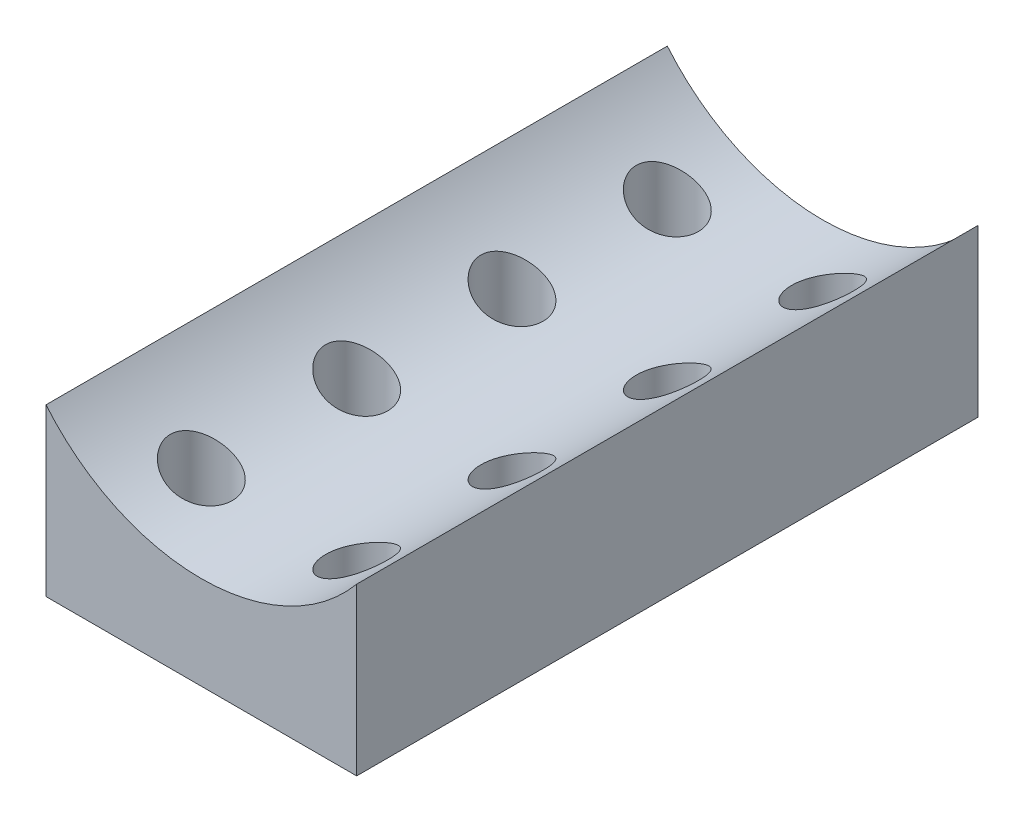
from build123d import *

# Parameters (mm, degrees)
BOSS_EXTRUDE1_DEPTH = 40
SKETCH2_R           = 2
CUT_EXTRUDE1_DEPTH  = 43.595167487


with BuildPart() as part:
    # Sketch1 → Boss-Extrude1 (new body)
    with BuildSketch(Plane.XY):
        with BuildLine():
            Line((-10, -5.346688069), (10, -5.346688069))
            Line((10, -5.346688069), (10, 5.346688069))
            ThreePointArc((10, 5.346688069), (0, 0.653311931), (-10, 5.346688069))
            Line((-10, 5.346688069), (-10, -5.346688069))
        make_face()
    extrude(amount=BOSS_EXTRUDE1_DEPTH)

    # Sketch2 → Cut-Extrude1 (cut, through all)
    with BuildSketch(Plane.XZ.offset(5.346688069)):
        with Locations((5, 5)):
            Circle(SKETCH2_R)
        with Locations((-5, 5)):
            Circle(SKETCH2_R)
        with Locations((-5, 15)):
            Circle(SKETCH2_R)
        with Locations((5, 15)):
            Circle(SKETCH2_R)
        with Locations((-5, 25)):
            Circle(SKETCH2_R)
        with Locations((5, 25)):
            Circle(SKETCH2_R)
        with Locations((-5, 35)):
            Circle(SKETCH2_R)
        with Locations((5, 35)):
            Circle(SKETCH2_R)
    extrude(amount=-CUT_EXTRUDE1_DEPTH, mode=Mode.SUBTRACT)


solid = part.part
